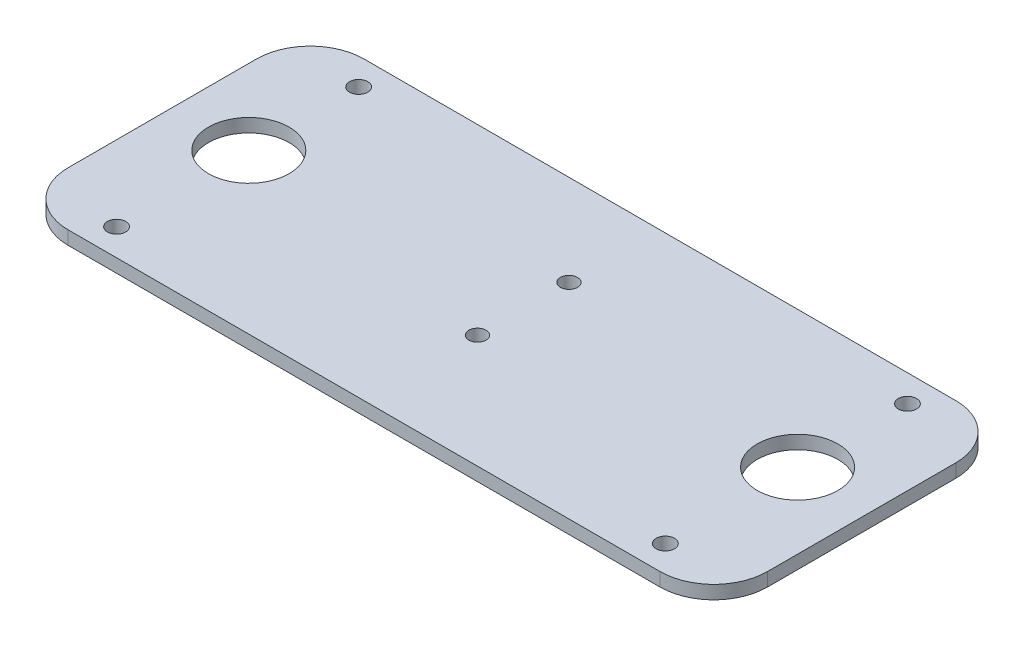
from build123d import *

# Parameters (mm, degrees)
BOSS_EXTRUDE1_DEPTH = 2.5
SKETCH2_R           = 1.7
SKETCH2_R_2         = 7.5
SKETCH2_R_3         = 1.6
CUT_EXTRUDE1_DEPTH  = 142.178079035


with BuildPart() as part:
    # Sketch1 → Boss-Extrude1 (new body)
    with BuildSketch(Plane(origin=(0, 0, 0), x_dir=(1, 0, 0), z_dir=(0, 1, 0))):
        with BuildLine():
            Line((10, 0), (120, 0))
            ThreePointArc((120, 0), (127.071067812, 2.928932188), (130, 10))
            Line((130, 10), (130, 45))
            ThreePointArc((130, 45), (127.071067812, 52.071067812), (120, 55))
            Line((120, 55), (10, 55))
            ThreePointArc((10, 55), (2.928932188, 52.071067812), (0, 45))
            Line((0, 45), (0, 10))
            ThreePointArc((0, 10), (2.928932188, 2.928932188), (10, 0))
        make_face()
    extrude(amount=BOSS_EXTRUDE1_DEPTH)

    # Sketch2 → Cut-Extrude1 (cut, through all)
    with BuildSketch(Plane(origin=(0, 2.5, 0), x_dir=(1, 0, 0), z_dir=(0, 1, 0))):
        with Locations((14, 5)):
            Circle(SKETCH2_R)
        with Locations((14, 50)):
            Circle(SKETCH2_R)
        with Locations((116, 5)):
            Circle(SKETCH2_R)
        with Locations((116, 50)):
            Circle(SKETCH2_R)
        with Locations((14, 29.578272248)):
            Circle(SKETCH2_R_2)
        with Locations((116, 29.578272248)):
            Circle(SKETCH2_R_2)
        with Locations((65, 38.078272248)):
            Circle(SKETCH2_R_3)
        with Locations((65, 21.078272248)):
            Circle(SKETCH2_R_3)
    extrude(amount=-CUT_EXTRUDE1_DEPTH, mode=Mode.SUBTRACT)


solid = part.part
